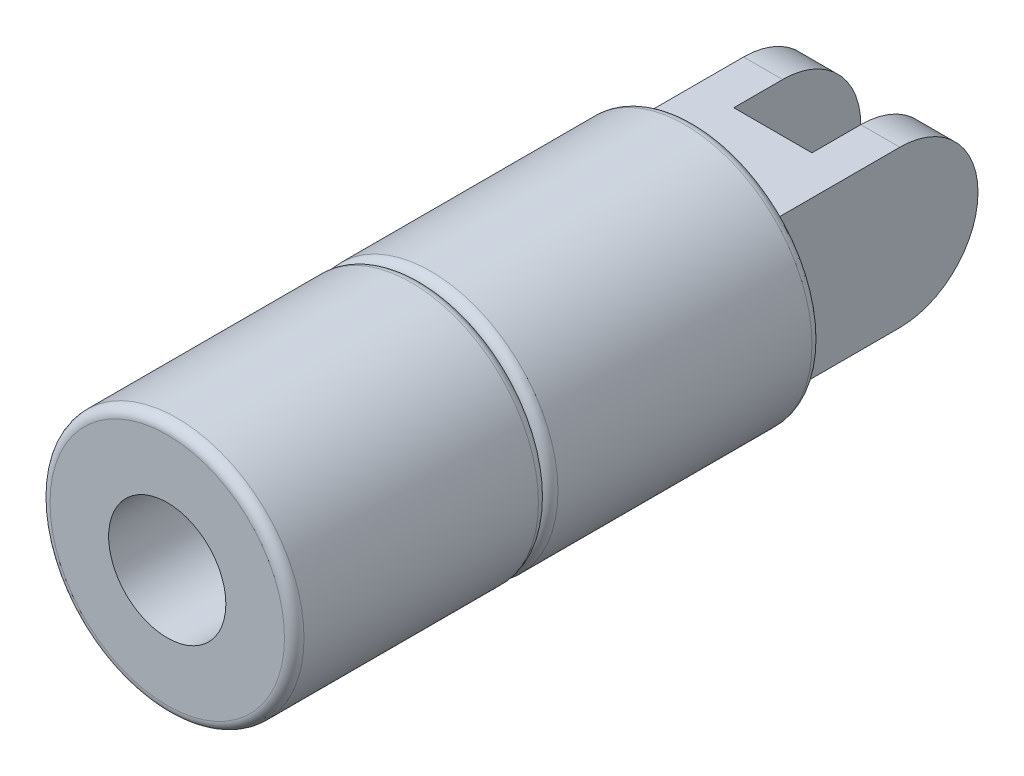
from build123d import *

# Parameters (mm, degrees)
SKETCH1_R           = 6.5
BOSS_EXTRUDE1_DEPTH = 13
FILLET1_R           = 0.5
SKETCH2_R           = 3
CUT_EXTRUDE1_DEPTH  = 6
BOSS_EXTRUDE2_START = 14
SKETCH3_R           = 6.5
BOSS_EXTRUDE2_DEPTH = 14
FILLET2_R           = 0.5
SKETCH4_W           = 8
SKETCH4_H           = 8
BOSS_EXTRUDE3_DEPTH = 4
SKETCH5_W           = 2
SKETCH5_H           = 8
BOSS_EXTRUDE4_DEPTH = 2.5
SKETCH6_R           = 4
BOSS_EXTRUDE5_DEPTH = 2


with BuildPart() as part:
    # Sketch1 → Boss-Extrude1 (new body)
    with BuildSketch(Plane.XY):
        with Locations(Location((0, 0, 0), (0, 0, 180))):
            Circle(SKETCH1_R)
    extrude(amount=BOSS_EXTRUDE1_DEPTH)

    # Fillet1
    fillet1_edges = [part.edges().sort_by_distance(p)[0] for p in [
        (6.5, 0, 0),
        (6.5, 0, 13),
    ]]
    fillet(fillet1_edges, radius=FILLET1_R)

    # Sketch2 → Cut-Extrude1 (cut)
    with BuildSketch(Plane.XY.offset(13)):
        Circle(SKETCH2_R)
    extrude(amount=-CUT_EXTRUDE1_DEPTH, mode=Mode.SUBTRACT)

    # Sketch3 → Boss-Extrude2 (add)
    with BuildSketch(Plane(origin=(0, 0, 0), x_dir=(-1, 0, 0), z_dir=(0, 0, -1)).offset(BOSS_EXTRUDE2_START)):
        Circle(SKETCH3_R)
    extrude(amount=-BOSS_EXTRUDE2_DEPTH)

    # Fillet2
    fillet2_edges = [part.edges().sort_by_distance(p)[0] for p in [
        (6.5, 0, 0),
        (6.5, 0, -14),
    ]]
    fillet(fillet2_edges, radius=FILLET2_R - 0.0001)  # a hair under: the kernel refuses the full size

    # Sketch4 → Boss-Extrude3 (add)
    with BuildSketch(Plane(origin=(0, 0, -14), x_dir=(-1, 0, 0), z_dir=(0, 0, -1))):
        Rectangle(SKETCH4_W, SKETCH4_H)
    extrude(amount=BOSS_EXTRUDE3_DEPTH)

    # Sketch5 → Boss-Extrude4 (add)
    with BuildSketch(Plane(origin=(0, 0, -18), x_dir=(-1, 0, 0), z_dir=(0, 0, -1))):
        with Locations((-3, 0)):
            Rectangle(SKETCH5_W, SKETCH5_H)
        with Locations((3, 0)):
            Rectangle(SKETCH5_W, SKETCH5_H)
    extrude(amount=BOSS_EXTRUDE4_DEPTH)

    # Sketch6 → Boss-Extrude5 (add)
    with BuildSketch(Plane(origin=(4, 0, 0), x_dir=(0, 0, -1), z_dir=(1, 0, 0))):
        with Locations((20.5, 0)):
            Circle(SKETCH6_R)
    boss_extrude5 = extrude(amount=-BOSS_EXTRUDE5_DEPTH)

    # Mirror1: Boss-Extrude5 across plane
    add(boss_extrude5.mirror(Plane(origin=(0, 0, 0), x_dir=(0, 0, 1), z_dir=(1, 0, 0))))


solid = part.part
